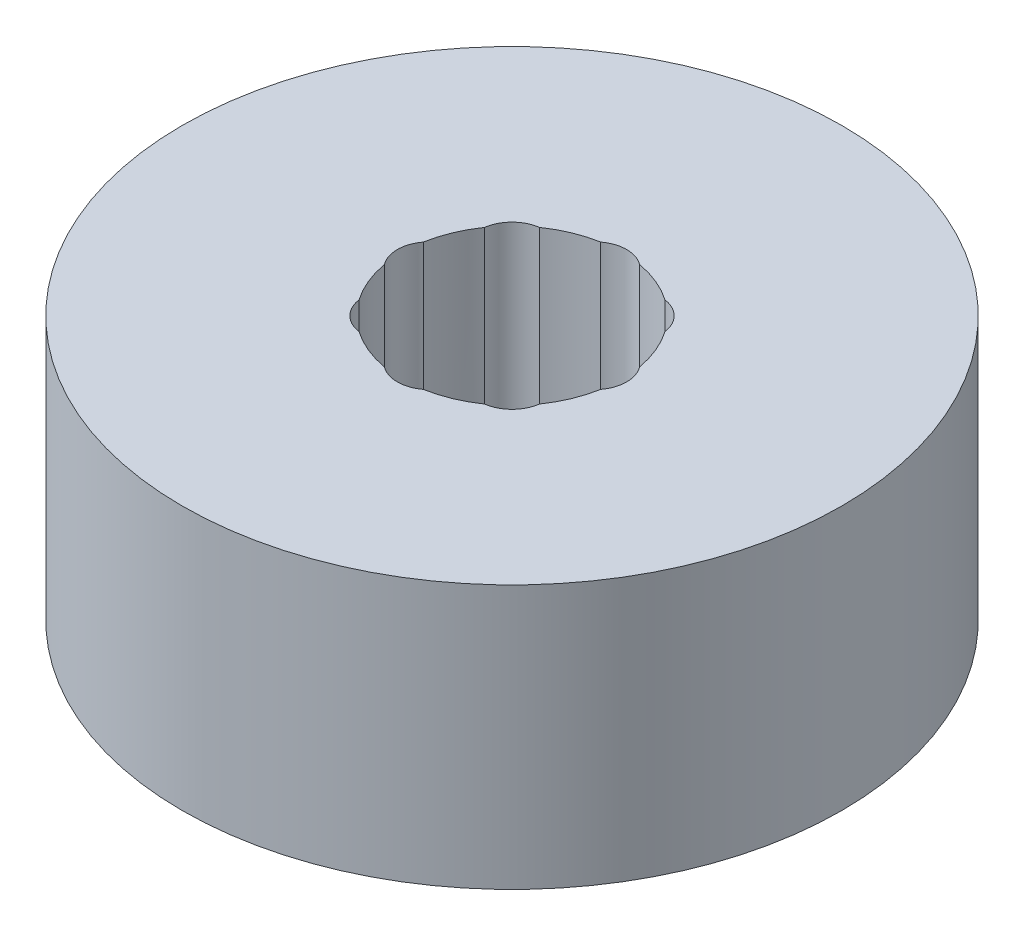
from build123d import *

# Parameters (mm, degrees)
SKETCH1_R           = 22.5
BOSS_EXTRUDE1_DEPTH = 18
SKETCH2_R           = 7.5
CUT_EXTRUDE1_DEPTH  = 37.558172821
SKETCH3_R           = 2.206373139
CUT_EXTRUDE2_DEPTH  = 13.992244391
CIRPATTERN1_COUNT   = 8


with BuildPart() as part:
    # Sketch1 → Boss-Extrude1 (new body)
    with BuildSketch(Plane(origin=(0, 0, 0), x_dir=(1, 0, 0), z_dir=(0, 1, 0))):
        Circle(SKETCH1_R)
    extrude(amount=BOSS_EXTRUDE1_DEPTH)

    # Sketch2 → Cut-Extrude1 (cut, through all)
    with BuildSketch(Plane(origin=(0, 0, 0), x_dir=(1, 0, 0), z_dir=(0, 1, 0))):
        Circle(SKETCH2_R)
    extrude(amount=CUT_EXTRUDE1_DEPTH, mode=Mode.SUBTRACT)

    # Sketch3 → Cut-Extrude2 (cut)
    with BuildSketch(Plane(origin=(0, 18, 0), x_dir=(1, 0, 0), z_dir=(0, 1, 0))):
        with Locations((-5.619930475, 0)):
            Circle(SKETCH3_R)
    cut_extrude2 = extrude(amount=-CUT_EXTRUDE2_DEPTH, mode=Mode.SUBTRACT)

    # CirPattern1: Cut-Extrude2 ×8 about axis
    cirpattern1_axis = Axis((0, 0, 0), (0, 1, 0))
    for i in range(1, CIRPATTERN1_COUNT):
        add(cut_extrude2.rotate(cirpattern1_axis, i * 360 / CIRPATTERN1_COUNT), mode=Mode.SUBTRACT)


solid = part.part
